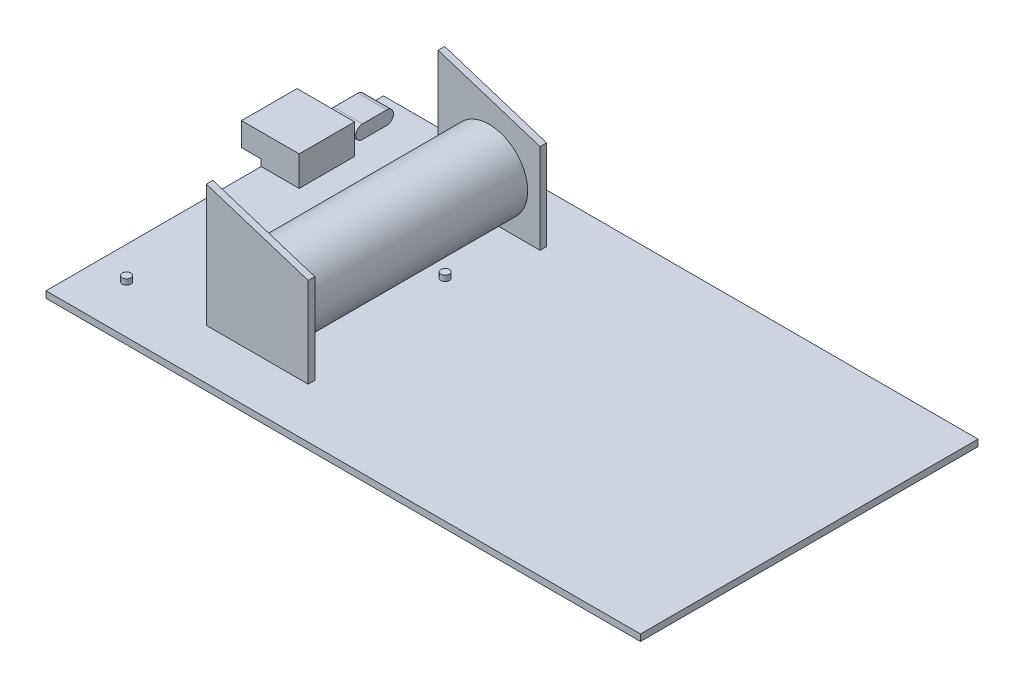
from build123d import *

# Parameters (mm, degrees)
SKETCH1_W                = 140.9
SKETCH1_H                = 80
PCB_DEPTH                = 1.55
BODYC_DEPTH              = 0.4
BODYC_DEPTH_BACK         = 6.45
BOSS_EXTRUDE4_DEPTH      = 7.1
BOSS_EXTRUDE4_DEPTH_BACK = 1.55
SKETCH4_W                = 13.65
SKETCH4_H                = 13.15
SKETCH5_W                = 4.65
SKETCH5_H                = 3.1
CUT_EXTRUDE3_DEPTH       = 14.1
SKETCH11_W               = 24.15
SKETCH11_H               = 1.55
BOSS_EXTRUDE8_DEPTH      = 29
SKETCH7_W                = 24.15
SKETCH7_H                = 1.55
BOSS_EXTRUDE5_DEPTH      = 29
CUT_EXTRUDE4_DEPTH       = 89
BATTERY_DEPTH            = 54
SKETCH13_R               = 1
BUTTON_DEPTH             = 1.3
SKETCH14_R               = 1
RESET_DEPTH              = 1.3


with BuildPart() as part:
    # Sketch1 → PCB (new body)
    with BuildSketch(Plane(origin=(0, 0, 0), x_dir=(1, 0, 0), z_dir=(0, 1, 0))):
        Rectangle(SKETCH1_W, SKETCH1_H)
    extrude(amount=PCB_DEPTH)

    # Sketch3 → bodyC (add, two sides: drawn at the far end of the back side and taken through both)
    with BuildSketch(Plane.ZY.offset(70.45).offset(-BODYC_DEPTH_BACK)):
        with BuildLine():
            Line((-34.3, 4.75), (-28.56, 4.75))
            ThreePointArc((-28.56, 4.75), (-26.96, 3.15), (-28.56, 1.55))
            Line((-28.56, 1.55), (-34.3, 1.55))
            ThreePointArc((-34.3, 1.55), (-35.9, 3.15), (-34.3, 4.75))
        make_face()
    extrude(amount=BODYC_DEPTH + BODYC_DEPTH_BACK)

    # Sketch4 → Boss-Extrude4 (add, two sides: drawn at the far end of the back side and taken through both)
    with BuildSketch(Plane(origin=(0, 1.55, 0), x_dir=(1, 0, 0), z_dir=(0, 1, 0)).offset(-BOSS_EXTRUDE4_DEPTH_BACK)):
        with Locations((-68.275, 17.575)):
            Rectangle(SKETCH4_W, SKETCH4_H)
    extrude(amount=BOSS_EXTRUDE4_DEPTH + BOSS_EXTRUDE4_DEPTH_BACK)

    # Sketch5 → Cut-Extrude3 (cut)
    with BuildSketch(Plane.XY.offset(-11)):
        with Locations((-72.775, 1.55)):
            Rectangle(SKETCH5_W, SKETCH5_H)
    extrude(amount=-CUT_EXTRUDE3_DEPTH, mode=Mode.SUBTRACT)

    # Sketch11 → Boss-Extrude8 (add)
    with BuildSketch(Plane(origin=(0, 1.55, 0), x_dir=(1, 0, 0), z_dir=(0, 1, 0))):
        with Locations((-32.275, 27.625)):
            Rectangle(SKETCH11_W, SKETCH11_H)
    extrude(amount=BOSS_EXTRUDE8_DEPTH)

    # Sketch7 → Boss-Extrude5 (add)
    with BuildSketch(Plane(origin=(0, 1.55, 0), x_dir=(1, 0, 0), z_dir=(0, 1, 0))):
        with Locations((-32.275, -27.325)):
            Rectangle(SKETCH7_W, SKETCH7_H)
    extrude(amount=BOSS_EXTRUDE5_DEPTH)

    # Sketch8 → Cut-Extrude4 (cut)
    with BuildSketch(Plane.XY.offset(28.1)):
        Polygon((-44.35, 30.55), (-20.2, 22.85), (-20.2, 30.55), align=None)
    extrude(amount=-CUT_EXTRUDE4_DEPTH, mode=Mode.SUBTRACT)

    # Sketch12 → Battery (add)
    with BuildSketch(Plane.XY.offset(-26.85)):
        with BuildLine():
            ThreePointArc((-32.275, 3.1), (-25.804972952, 5.779972952), (-23.125, 12.25))
            ThreePointArc((-23.125, 12.25), (-38.745027048, 18.720027048), (-32.275, 3.1))
        make_face()
    extrude(amount=BATTERY_DEPTH)

    # Sketch13 → Button (add)
    with BuildSketch(Plane(origin=(0, 1.55, 0), x_dir=(1, 0, 0), z_dir=(0, 1, 0))):
        with Locations((-62.75, -28.6)):
            Circle(SKETCH13_R)
    extrude(amount=BUTTON_DEPTH)

    # Sketch14 → Reset (add)
    with BuildSketch(Plane(origin=(0, 1.55, 0), x_dir=(1, 0, 0), z_dir=(0, 1, 0))):
        with Locations((-25.75, 9.9)):
            Circle(SKETCH14_R)
    extrude(amount=RESET_DEPTH)


solid = part.part
